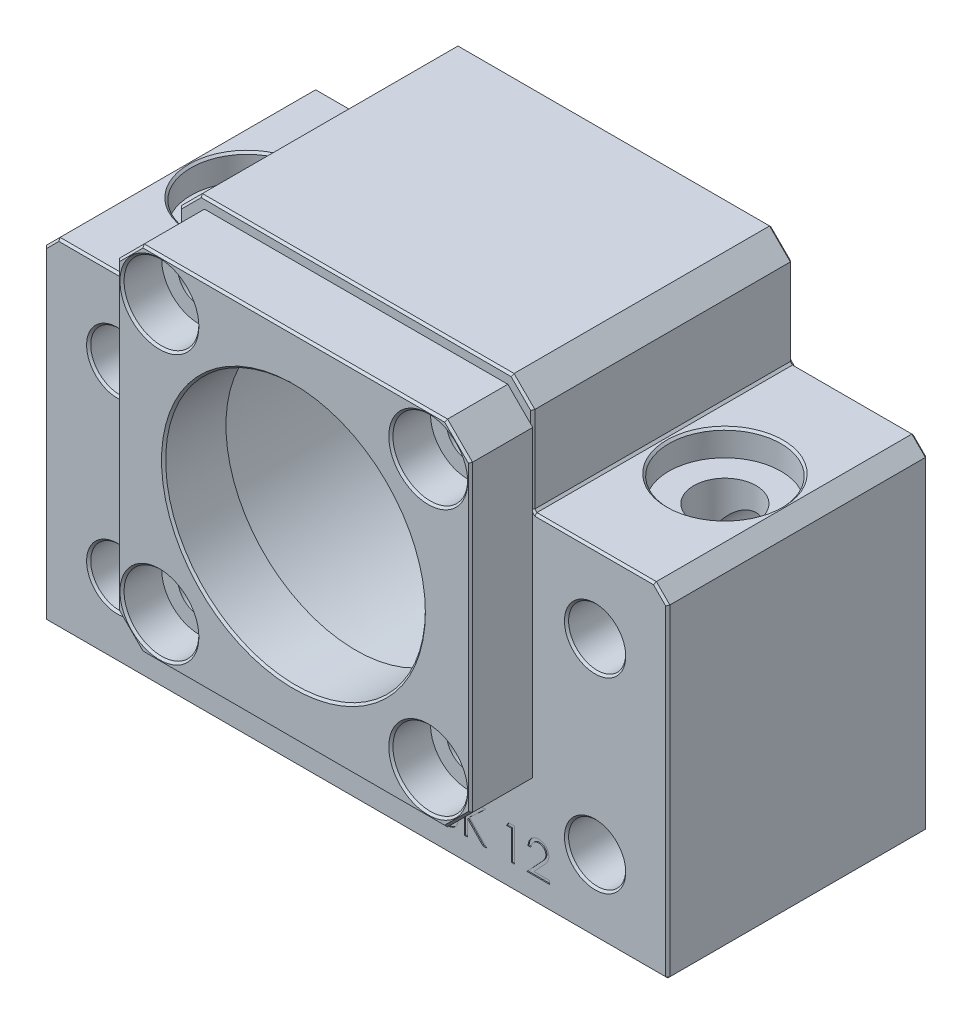
from build123d import *

# Parameters (mm, degrees)
SKETCH2_R                                    = 12.5
SKETCH2_R_2                                  = 2.75
BOSS_EXTRUDE1_DEPTH                          = 25
CHAMFER1_SIZE                                = 2
SKETCH7_R                                    = 3
CUT_EXTRUDE4_DEPTH                           = 51.806003582
SKETCH8_R                                    = 5.4
CUT_EXTRUDE5_DEPTH                           = 2.5
CHAMFER4_SIZE                                = 0.2
CHAMFER5_SIZE                                = 1.3
CHAMFER6_SIZE                                = 0.2
SKETCH15_W                                   = 34
SKETCH15_H                                   = 34
SKETCH15_R                                   = 12.5
BOSS_EXTRUDE9_DEPTH                          = 6
CHAMFER8_SIZE                                = 2.4
CBORE_FOR_M4_HEXAGON_SOCKET_HEAD_CAP_2_COUNT = 2
CBORE_FOR_M4_HEXAGON_SOCKET_HEAD_CAP_2_PITCH = 25.880108191
CBORE_FOR_M4_HEXAGON_SOCKET_HEAD_CAP_3_COUNT = 2
CBORE_FOR_M4_HEXAGON_SOCKET_HEAD_CAP_3_PITCH = 36.6
CBORE_FOR_M4_HEXAGON_SOCKET_HEAD_CAP_4_COUNT = 2
CBORE_FOR_M4_HEXAGON_SOCKET_HEAD_CAP_4_PITCH = 25.880108191
CHAMFER11_SIZE                               = 0.2
SKETCH25_R                                   = 16
CUT_EXTRUDE8_DEPTH                           = 20
CUT_EXTRUDE9_DEPTH                           = 0.1


with BuildPart() as part:
    # Sketch2 → Boss-Extrude1 (new body)
    with BuildSketch(Plane.XY):
        Polygon((30, -25), (-30, -25), (-30, 7.5), (-17, 7.5), (-17, 18), (17, 18), (17, 7.5), (30, 7.5), align=None)
        Circle(SKETCH2_R, mode=Mode.SUBTRACT)
        with Locations((-23, 0)):
            Circle(SKETCH2_R_2, mode=Mode.SUBTRACT)
        with Locations((23, 0)):
            Circle(SKETCH2_R_2, mode=Mode.SUBTRACT)
        with Locations((-23, -18)):
            Circle(SKETCH2_R_2, mode=Mode.SUBTRACT)
        with Locations((23, -18)):
            Circle(SKETCH2_R_2, mode=Mode.SUBTRACT)
    extrude(amount=-BOSS_EXTRUDE1_DEPTH)

    # Chamfer1
    chamfer1_edges = [part.edges().sort_by_distance(p)[0] for p in [
        (-17, 18, -12.5),
        (17, 18, -12.5),
    ]]
    chamfer(chamfer1_edges, length=CHAMFER1_SIZE)

    # Sketch7 → Cut-Extrude4 (cut, through all)
    with BuildSketch(Plane(origin=(0, 7.5, 0), x_dir=(1, 0, 0), z_dir=(0, 1, 0))):
        with Locations(Location((-23, 12.5, 0), (0, 0, 270))):
            Circle(SKETCH7_R)
        with Locations(Location((23, 12.5, 0), (0, 0, 90))):
            Circle(SKETCH7_R)
    extrude(amount=-CUT_EXTRUDE4_DEPTH, mode=Mode.SUBTRACT)

    # Sketch8 → Cut-Extrude5 (cut)
    with BuildSketch(Plane(origin=(0, 7.5, 0), x_dir=(1, 0, 0), z_dir=(0, 1, 0))):
        with Locations(Location((-23, 12.5, 0), (0, 0, 270))):
            Circle(SKETCH8_R)
        with Locations(Location((23, 12.5, 0), (0, 0, 90))):
            Circle(SKETCH8_R)
    extrude(amount=-CUT_EXTRUDE5_DEPTH, mode=Mode.SUBTRACT)

    # Chamfer4
    chamfer4_edges = [part.edges().sort_by_distance(p)[0] for p in [
        (17, 11.75, -25),
        (20.25, 0, 0),
        (20.25, -18, 0),
        (-25.75, -18, 0),
        (-25.75, 0, 0),
        (23.5, 7.5, 0),
        (30, -8.75, 0),
        (0, -25, 0),
        (-30, -8.75, 0),
        (-23.5, 7.5, 0),
        (-17, 11.75, 0),
        (17, 11.75, 0),
        (-12.5, 0, 0),
        (-17, 11.75, -25),
        (17, 7.5, -12.5),
        (30, -25, -12.5),
        (-30, -25, -12.5),
        (-17, 7.5, -12.5),
        (-23.5, 7.5, -25),
        (-30, -8.75, -25),
        (0, -25, -25),
        (30, -8.75, -25),
        (0, 18, 0),
        (-16, 17, 0),
        (16, 17, 0),
        (0, 18, -25),
        (23.5, 7.5, -25),
        (-16, 17, -25),
        (16, 17, -25),
        (-25.75, 0, -25),
        (-25.75, -18, -25),
        (20.25, -18, -25),
        (-23, -25, -15.5),
        (20.25, 0, -25),
        (23, -25, -9.5),
        (-23, 7.5, -17.9),
        (23, 7.5, -7.1),
        (-12.5, 0, -25),
    ]]
    chamfer(chamfer4_edges, length=CHAMFER4_SIZE)

    # Chamfer5
    # the kernel refuses this chamfer: 1.3 mm, written as the material it takes off along each edge
    with BuildSketch(Plane(origin=(30, 7.5, 3.143187884), x_dir=(-0.9996219169112966, 0.0274958766105867, 0), z_dir=(0, 0, -1))) as chamfer5_piece_1:
        Polygon((CHAMFER5_SIZE * 0.999621916911, -CHAMFER5_SIZE * 0.0274958766106), (-CHAMFER5_SIZE * 0.0274958766106, -CHAMFER5_SIZE * 0.999621916911), (0, 0), align=None)
    extrude(amount=31.286375769, mode=Mode.SUBTRACT)
    with BuildSketch(Plane(origin=(-30, 7.5, 3.143187884), x_dir=(0.9996219169112966, 0.0274958766105867, 0), z_dir=(0, 0, -1))) as chamfer5_piece_2:
        Polygon((CHAMFER5_SIZE * 0.999621916911, CHAMFER5_SIZE * 0.0274958766106), (-CHAMFER5_SIZE * 0.0274958766106, CHAMFER5_SIZE * 0.999621916911), (0, 0), align=None)
    extrude(amount=31.286375769, mode=Mode.SUBTRACT)

    # Chamfer6
    chamfer6_edges = [part.edges().sort_by_distance(p)[0] for p in [
        (29.35, 6.85, -25),
        (-29.35, 6.85, -25),
        (-29.35, 6.85, 0),
        (29.35, 6.85, 0),
    ]]
    chamfer(chamfer6_edges, length=CHAMFER6_SIZE)


with BuildPart() as body_2:
    # Sketch15 → Boss-Extrude9 (new body)
    with BuildSketch(Plane.XY):
        Rectangle(SKETCH15_W, SKETCH15_H)
        with Locations((-0.036213621, 0)):
            Circle(SKETCH15_R, mode=Mode.SUBTRACT)
    extrude(amount=BOSS_EXTRUDE9_DEPTH)

    # Chamfer8
    chamfer8_edges = [body_2.edges().sort_by_distance(p)[0] for p in [
        (-17, 17, 3),
        (17, 17, 3),
        (17, -17, 3),
        (-17, -17, 3),
    ]]
    chamfer(chamfer8_edges, length=CHAMFER8_SIZE)


with BuildPart() as cbore_for_m4_hexagon_socket_head_cap_scr_tool:
    # Sketch22 → CBORE for M4 Hexagon socket head cap screws1 (revolve)
    with BuildSketch(Plane(origin=(12.940054096, 12.940054096, 6), x_dir=(0, -1, 0), z_dir=(1, 0, 0))):
        Polygon((0, 0), (0, 21.231764269), (2.05, 20), (2.05, 3.82), (3.6, 3.82), (3.6, 0), align=None)
    cbore_for_m4_hexagon_socket_head_cap_scr = revolve(axis=Axis((12.940054096, 12.940054096, 12.35), (0, 0, -1)))


with BuildPart() as part_1:
    add(part.part)

    # CBORE for M4 Hexagon socket head cap screws1: cut by cbore_for_m4_hexagon_socket_head_cap_scr_tool
    add(cbore_for_m4_hexagon_socket_head_cap_scr_tool.part, mode=Mode.SUBTRACT)


with BuildPart() as body_2_1:
    add(body_2.part)

    # CBORE for M4 Hexagon socket head cap screws1: cut by cbore_for_m4_hexagon_socket_head_cap_scr_tool
    add(cbore_for_m4_hexagon_socket_head_cap_scr_tool.part, mode=Mode.SUBTRACT)


with BuildPart() as cbore_for_m4_hexagon_socket_head_cap_2_tool:
    # CBORE for M4 Hexagon socket head cap 2: CBORE for M4 Hexagon socket head cap screws1 ×2
    with Locations(*[(-i * CBORE_FOR_M4_HEXAGON_SOCKET_HEAD_CAP_2_PITCH, 0, 0) for i in range(1, CBORE_FOR_M4_HEXAGON_SOCKET_HEAD_CAP_2_COUNT)]):
        add(cbore_for_m4_hexagon_socket_head_cap_scr)


with BuildPart() as part_2:
    add(part_1.part)

    # CBORE for M4 Hexagon socket head cap 2: cut by cbore_for_m4_hexagon_socket_head_cap_2_tool
    add(cbore_for_m4_hexagon_socket_head_cap_2_tool.part, mode=Mode.SUBTRACT)


with BuildPart() as body_2_2:
    add(body_2_1.part)

    # CBORE for M4 Hexagon socket head cap 2: cut by cbore_for_m4_hexagon_socket_head_cap_2_tool
    add(cbore_for_m4_hexagon_socket_head_cap_2_tool.part, mode=Mode.SUBTRACT)


with BuildPart() as cbore_for_m4_hexagon_socket_head_cap_3_tool:
    # CBORE for M4 Hexagon socket head cap 3: CBORE for M4 Hexagon socket head cap screws1 ×2
    with Locations(*[Vector(-0.7071067811865478, -0.7071067811865474, 0) * (i * CBORE_FOR_M4_HEXAGON_SOCKET_HEAD_CAP_3_PITCH) for i in range(1, CBORE_FOR_M4_HEXAGON_SOCKET_HEAD_CAP_3_COUNT)]):
        add(cbore_for_m4_hexagon_socket_head_cap_scr)


with BuildPart() as part_3:
    add(part_2.part)

    # CBORE for M4 Hexagon socket head cap 3: cut by cbore_for_m4_hexagon_socket_head_cap_3_tool
    add(cbore_for_m4_hexagon_socket_head_cap_3_tool.part, mode=Mode.SUBTRACT)


with BuildPart() as body_2_3:
    add(body_2_2.part)

    # CBORE for M4 Hexagon socket head cap 3: cut by cbore_for_m4_hexagon_socket_head_cap_3_tool
    add(cbore_for_m4_hexagon_socket_head_cap_3_tool.part, mode=Mode.SUBTRACT)


with BuildPart() as cbore_for_m4_hexagon_socket_head_cap_4_tool:
    # CBORE for M4 Hexagon socket head cap 4: CBORE for M4 Hexagon socket head cap screws1 ×2
    with Locations(*[(0, -i * CBORE_FOR_M4_HEXAGON_SOCKET_HEAD_CAP_4_PITCH, 0) for i in range(1, CBORE_FOR_M4_HEXAGON_SOCKET_HEAD_CAP_4_COUNT)]):
        add(cbore_for_m4_hexagon_socket_head_cap_scr)


with BuildPart() as part_4:
    add(part_3.part)

    # CBORE for M4 Hexagon socket head cap 4: cut by cbore_for_m4_hexagon_socket_head_cap_4_tool
    add(cbore_for_m4_hexagon_socket_head_cap_4_tool.part, mode=Mode.SUBTRACT)

    # Sketch25 → Cut-Extrude8 (cut)
    with BuildSketch(Plane.XY):
        Circle(SKETCH25_R)
    extrude(amount=-CUT_EXTRUDE8_DEPTH, mode=Mode.SUBTRACT)

    # Sketch28 → Cut-Extrude9 (cut)
    # profile 1 of 4: a face of its own
    with BuildSketch(Plane.XY):
        with BuildLine():
            Line((7.92629415, -19.51726103), (8.54577532, -19.51726103))
            add(Edge.make_bspline(
                [(8.54577532, -19.51726103), (8.576099725, -19.51742046), (8.634875969, -19.517729477), (8.720346463, -19.522522032), (8.800400741, -19.529056789), (8.87506202, -19.539425516), (8.944295801, -19.551936628), (9.008310729, -19.567087561), (9.066903242, -19.585254561), (9.13685551, -19.614143688), (9.21661211, -19.657072562), (9.302970651, -19.72050776), (9.376815926, -19.798097923), (9.440484942, -19.885621475), (9.491104529, -19.981901782), (9.527725249, -20.084644046), (9.550909893, -20.192523055), (9.553294258, -20.26658508), (9.554499278, -20.304014836)],
                knots=[0, 0, 0, 0, 1.001505555, 1.941167018, 2.826882275, 3.653841531, 4.429895133, 5.150066043, 5.825578002, 6.45369114, 7.647487171, 8.808567382, 9.977351308, 11.170798116, 12.373658725, 13.556498008, 14.765093433, 16, 16, 16, 16], degree=3))
            add(Edge.make_bspline(
                [(9.554499278, -20.304014836), (9.553507573, -20.339078226), (9.551558778, -20.407981093), (9.532923561, -20.508759321), (9.50374924, -20.604690784), (9.463195193, -20.695425376), (9.410488382, -20.778913011), (9.34802405, -20.855827174), (9.272661522, -20.922911347), (9.216198012, -20.960415266), (9.187517107, -20.979465557)],
                knots=[0, 0, 0, 0, 1.044552857, 2.05264487, 3.044412934, 4.028983338, 5.005914585, 5.980388656, 6.974128949, 8, 8, 8, 8], degree=3))
            add(Edge.make_bspline(
                [(9.187517107, -20.979465557), (9.223585495, -20.993313092), (9.292593255, -21.019806856), (9.387558424, -21.066647598), (9.469378033, -21.117594656), (9.538681158, -21.173231405), (9.597951745, -21.233201541), (9.649706914, -21.298384395), (9.693867875, -21.369630268), (9.731707455, -21.446196332), (9.761233827, -21.527300771), (9.783346254, -21.612182832), (9.796016726, -21.700538143), (9.797819801, -21.760668451), (9.798730047, -21.791024051)],
                knots=[0, 0, 0, 0, 1.27268992, 2.434971085, 3.483601985, 4.442670788, 5.356604649, 6.2567628, 7.179492994, 8.113709626, 9.066344395, 10.018646069, 10.999752585, 12, 12, 12, 12], degree=3))
            add(Edge.make_bspline(
                [(9.798730047, -21.791024051), (9.797843908, -21.822018285), (9.796100405, -21.883000308), (9.783237145, -21.972585323), (9.761457455, -22.058196882), (9.731457201, -22.140388726), (9.692302816, -22.219001848), (9.644652448, -22.294125309), (9.587836673, -22.365004309), (9.524279641, -22.432426453), (9.452377552, -22.493048803), (9.374802546, -22.547038051), (9.29057767, -22.591439122), (9.201086218, -22.628737227), (9.105324303, -22.657228043), (9.003721938, -22.677160306), (8.89636675, -22.69059059), (8.822697904, -22.691694768), (8.784917948, -22.69226103)],
                knots=[0, 0, 0, 0, 0.978564426, 1.925352924, 2.850884081, 3.763762016, 4.682927383, 5.618979971, 6.567305752, 7.547517671, 8.540179244, 9.531824382, 10.526200242, 11.540722885, 12.589160233, 13.674978461, 14.80764778, 16, 16, 16, 16], degree=3))
            Line((8.784917948, -22.69226103), (7.92629415, -22.69226103))
            Line((7.92629415, -22.69226103), (7.92629415, -19.51726103))
        make_face()
        with BuildLine():
            Line((8.211230047, -19.842902055), (8.211230047, -20.860530261))
            Line((8.211230047, -20.860530261), (8.402671353, -20.860530261))
            add(Edge.make_bspline(
                [(8.402671353, -20.860530261), (8.430655618, -20.860167473), (8.484726919, -20.859466494), (8.563031397, -20.857458518), (8.635716235, -20.851836007), (8.702655969, -20.846215112), (8.763745186, -20.837076022), (8.818848546, -20.826197453), (8.868830845, -20.814692247), (8.92647029, -20.795125641), (8.99185075, -20.766208035), (9.061549352, -20.721330013), (9.122994192, -20.667877206), (9.174880212, -20.606199691), (9.217344904, -20.538285365), (9.246839488, -20.465217838), (9.266839524, -20.388818147), (9.268646128, -20.336368732), (9.269563381, -20.309738994)],
                knots=[0, 0, 0, 0, 1.156816544, 2.235205308, 3.236616184, 4.169592532, 5.011045266, 5.787822928, 6.49130361, 7.128639758, 8.301311294, 9.436451833, 10.541879658, 11.654887649, 12.756523258, 13.837046038, 14.901820046, 16, 16, 16, 16], degree=3))
            add(Edge.make_bspline(
                [(9.269563381, -20.309738994), (9.26908606, -20.292117045), (9.268149744, -20.257549666), (9.260481391, -20.207158466), (9.247447948, -20.159765919), (9.230707268, -20.114722547), (9.207313243, -20.073436798), (9.179769244, -20.034481184), (9.146490082, -19.999182334), (9.108610234, -19.966190003), (9.065059555, -19.93693961), (9.015864026, -19.911321204), (8.960358062, -19.890692071), (8.899477115, -19.872625275), (8.832284057, -19.859935894), (8.759554283, -19.849364607), (8.680692074, -19.843982762), (8.626131874, -19.843270326), (8.597928765, -19.842902055)],
                knots=[0, 0, 0, 0, 0.91205012, 1.789085906, 2.630437955, 3.453916878, 4.269457761, 5.079663411, 5.91843418, 6.774407191, 7.675494373, 8.627863946, 9.638891023, 10.736472738, 11.911756761, 13.175263542, 14.539845004, 16, 16, 16, 16], degree=3))
            Line((8.597928765, -19.842902055), (8.211230047, -19.842902055))
        make_face(mode=Mode.SUBTRACT)
        with BuildLine():
            Line((8.211230047, -21.186171286), (8.211230047, -22.366620004))
            Line((8.211230047, -22.366620004), (8.617009294, -22.366620004))
            add(Edge.make_bspline(
                [(8.617009294, -22.366620004), (8.646055034, -22.36627189), (8.702036869, -22.365600947), (8.782864413, -22.363410601), (8.857779086, -22.358428323), (8.926439038, -22.350585302), (8.989585662, -22.342077709), (9.046461436, -22.330637475), (9.097527404, -22.317530204), (9.156740526, -22.297269919), (9.223418709, -22.265795263), (9.295274271, -22.218338786), (9.359160912, -22.161802643), (9.413412826, -22.096369599), (9.457874608, -22.025221181), (9.4902192, -21.949796471), (9.510168048, -21.871341743), (9.512583016, -21.817850511), (9.51379415, -21.791024051)],
                knots=[0, 0, 0, 0, 1.160039823, 2.235823828, 3.228722157, 4.157150951, 4.99529583, 5.772374946, 6.472645482, 7.099169577, 8.269452708, 9.405989375, 10.527446681, 11.663510218, 12.788923519, 13.866172445, 14.929861265, 16, 16, 16, 16], degree=3))
            add(Edge.make_bspline(
                [(9.51379415, -21.791024051), (9.513543684, -21.774247949), (9.513046792, -21.740966345), (9.505553234, -21.692056995), (9.494654938, -21.644680667), (9.480565708, -21.598708717), (9.46004662, -21.554972297), (9.436092112, -21.512606404), (9.408005697, -21.471555033), (9.364241347, -21.419655346), (9.300585332, -21.359859198), (9.210137043, -21.301314464), (9.107292173, -21.254099668), (9.03270009, -21.234052286), (8.994167748, -21.223696326)],
                knots=[0, 0, 0, 0, 0.723448775, 1.435228256, 2.130040452, 2.821711965, 3.505591119, 4.210454504, 4.921174351, 5.648778258, 7.137944449, 8.670945889, 10.280296675, 12, 12, 12, 12], degree=3))
            add(Edge.make_bspline(
                [(8.994167748, -21.223696326), (8.978719925, -21.220562071), (8.945225859, -21.213766361), (8.890608983, -21.206592944), (8.82825573, -21.200202068), (8.75802212, -21.195474804), (8.679819293, -21.190588439), (8.593480231, -21.188688137), (8.499357524, -21.186420951), (8.434050158, -21.186256637), (8.400127283, -21.186171286)],
                knots=[0, 0, 0, 0, 0.634451884, 1.375622551, 2.216452059, 3.157844607, 4.20941857, 5.370758133, 6.634282058, 8, 8, 8, 8], degree=3))
            Line((8.400127283, -21.186171286), (8.211230047, -21.186171286))
        make_face(mode=Mode.SUBTRACT)
    # profile 2 of 4: a face of its own
    with BuildSketch(Plane.XY):
        Polygon((10.450012099, -19.51726103), (10.734947996, -19.51726103), (10.734947996, -20.726330541), (12.05850068, -19.51726103), (12.464915945, -19.51726103), (10.904764703, -20.941940517), (12.587031329, -22.69226103), (12.207328805, -22.69226103), (10.734947996, -21.160094563), (10.734947996, -22.69226103), (10.450012099, -22.69226103), align=None)
    # profile 3 of 4: a face of its own
    with BuildSketch(Plane.XY):
        Polygon((14.666172956, -19.51726103), (15.253217227, -19.51726103), (15.253217227, -22.69226103), (14.968281329, -22.69226103), (14.968281329, -19.842902055), (14.479819791, -19.842902055), align=None)
    # profile 4 of 4: a face of its own
    with BuildSketch(Plane.XY):
        with BuildLine():
            Line((16.840717227, -20.494184107), (16.555781329, -20.494184107))
            add(Edge.make_bspline(
                [(16.555781329, -20.494184107), (16.55763839, -20.456382658), (16.561285607, -20.38214162), (16.578365555, -20.273897791), (16.602804779, -20.170433795), (16.637359169, -20.072580373), (16.680272721, -19.979472312), (16.73173496, -19.891479441), (16.792689382, -19.808937434), (16.861819776, -19.732611483), (16.936902756, -19.66259133), (17.017916001, -19.602125502), (17.103046847, -19.551037329), (17.192037017, -19.508327917), (17.285890528, -19.476269628), (17.383755692, -19.452482855), (17.48606248, -19.438171455), (17.555767357, -19.436633136), (17.591218028, -19.435850773)],
                knots=[0, 0, 0, 0, 1.10065271, 2.161652631, 3.183658789, 4.190468796, 5.17591951, 6.163126047, 7.15150782, 8.156236427, 9.156009102, 10.134482811, 11.092018607, 12.041330605, 13.001268258, 13.972401359, 14.968799086, 16, 16, 16, 16], degree=3))
            add(Edge.make_bspline(
                [(17.591218028, -19.435850773), (17.626032424, -19.436665802), (17.694441468, -19.438267303), (17.794283438, -19.452020523), (17.889331413, -19.473561167), (17.979399601, -19.503783008), (18.063769388, -19.544408882), (18.143074578, -19.593210935), (18.218259314, -19.64965321), (18.285938325, -19.716104884), (18.348084939, -19.787045619), (18.401699128, -19.862781074), (18.447612498, -19.941003355), (18.48588275, -20.022308937), (18.514055105, -20.10746337), (18.535443908, -20.195226904), (18.547533776, -20.286507983), (18.549389267, -20.348290358), (18.550332611, -20.379700934)],
                knots=[0, 0, 0, 0, 1.111607364, 2.184268762, 3.212621178, 4.221274766, 5.211760367, 6.196651075, 7.1921475, 8.207485113, 9.220403448, 10.201281604, 11.166441695, 12.114753415, 13.065576456, 14.026450734, 14.996634279, 16, 16, 16, 16], degree=3))
            add(Edge.make_bspline(
                [(18.550332611, -20.379700934), (18.54879658, -20.423922184), (18.545751473, -20.511588663), (18.519703431, -20.640416431), (18.479021239, -20.765233319), (18.430037922, -20.865687871), (18.380623634, -20.946635398), (18.336094252, -21.013282009), (18.283965459, -21.085041969), (18.223478536, -21.161674982), (18.155884716, -21.243781304), (18.080571754, -21.331311332), (17.997002595, -21.423360723), (17.938348098, -21.486230805), (17.907954807, -21.518808506)],
                knots=[0, 0, 0, 0, 1.184426356, 2.348067706, 3.509069118, 4.696110526, 5.333549288, 6.050745305, 6.844228056, 7.710549037, 8.667450064, 9.695053472, 10.805634456, 12, 12, 12, 12], degree=3))
            Line((17.907954807, -21.518808506), (17.113568789, -22.366620004))
            Line((17.113568789, -22.366620004), (18.59103774, -22.366620004))
            Line((18.59103774, -22.366620004), (18.59103774, -22.69226103))
            Line((18.59103774, -22.69226103), (16.433665945, -22.69226103))
            Line((16.433665945, -22.69226103), (17.664996073, -21.37824861))
            add(Edge.make_bspline(
                [(17.664996073, -21.37824861), (17.694975227, -21.346953717), (17.752559048, -21.286842634), (17.834004671, -21.199082949), (17.907155753, -21.117667294), (17.972485817, -21.042749496), (18.028577639, -20.973233717), (18.078354593, -20.911371379), (18.118237665, -20.854444127), (18.161522345, -20.788457999), (18.203445028, -20.70789254), (18.239469808, -20.609436979), (18.261436135, -20.5080844), (18.264071236, -20.439593266), (18.265396714, -20.405141639)],
                knots=[0, 0, 0, 0, 1.329631726, 2.553950428, 3.673215718, 4.687767853, 5.603093632, 6.413772471, 7.123043292, 7.734684054, 8.834405432, 9.900288307, 10.943827018, 12, 12, 12, 12], degree=3))
            add(Edge.make_bspline(
                [(18.265396714, -20.405141639), (18.264820005, -20.383477799), (18.263683422, -20.34078253), (18.253652511, -20.278184449), (18.238493695, -20.217800653), (18.216771925, -20.159445406), (18.188100096, -20.103705422), (18.153199244, -20.05051285), (18.112931116, -19.99908786), (18.066348178, -19.950870226), (18.015174871, -19.906709418), (17.961114373, -19.867589712), (17.903918922, -19.83489709), (17.843829668, -19.808096918), (17.781014135, -19.787073536), (17.71535083, -19.77250611), (17.647021187, -19.763359857), (17.600363659, -19.762122358), (17.576589623, -19.761491799)],
                knots=[0, 0, 0, 0, 0.991446411, 1.95395049, 2.89581595, 3.838931463, 4.798493298, 5.75982156, 6.748411868, 7.785213223, 8.824556874, 9.840280684, 10.836137867, 11.835679398, 12.848801643, 13.863922112, 14.911575587, 16, 16, 16, 16], degree=3))
            add(Edge.make_bspline(
                [(17.576589623, -19.761491799), (17.551760367, -19.762140435), (17.502999809, -19.76341425), (17.431408972, -19.77232481), (17.363114017, -19.787697108), (17.297943148, -19.808721662), (17.235786095, -19.835444775), (17.176945141, -19.868729429), (17.121552377, -19.908447312), (17.069503674, -19.953478388), (17.021548493, -20.003613997), (16.979414541, -20.059503035), (16.942599042, -20.120125048), (16.910477809, -20.185316462), (16.88439229, -20.255668819), (16.864459504, -20.33093238), (16.84868715, -20.410780347), (16.843417992, -20.465921103), (16.840717227, -20.494184107)],
                knots=[0, 0, 0, 0, 1.031018746, 2.02475058, 2.990194455, 3.934040569, 4.864654155, 5.795059489, 6.735614925, 7.690564532, 8.649604399, 9.611025574, 10.590972636, 11.591080095, 12.624614302, 13.701020113, 14.821632451, 16, 16, 16, 16], degree=3))
        make_face()
    extrude(amount=-CUT_EXTRUDE9_DEPTH, mode=Mode.SUBTRACT)


with BuildPart() as body_2_4:
    add(body_2_3.part)

    # CBORE for M4 Hexagon socket head cap 4: cut by cbore_for_m4_hexagon_socket_head_cap_4_tool
    add(cbore_for_m4_hexagon_socket_head_cap_4_tool.part, mode=Mode.SUBTRACT)

    # Chamfer11
    chamfer11_edges = [body_2_4.edges().sort_by_distance(p)[0] for p in [
        (-12.536213621, 0, 6),
        (17, 0, 6),
        (0, -17, 6),
        (-17, 0, 6),
        (0, 17, 6),
        (15.8, 15.8, 6),
        (-15.8, 15.8, 6),
        (-15.8, -15.8, 6),
        (15.8, -15.8, 6),
        (12.940054096, -9.340054096, 6),
        (-12.940054096, -9.340054096, 6),
        (-12.940054096, 16.540054096, 6),
        (12.940054096, 16.540054096, 6),
    ]]
    chamfer(chamfer11_edges, length=CHAMFER11_SIZE)


solid = Compound([part_4.part, body_2_4.part])
